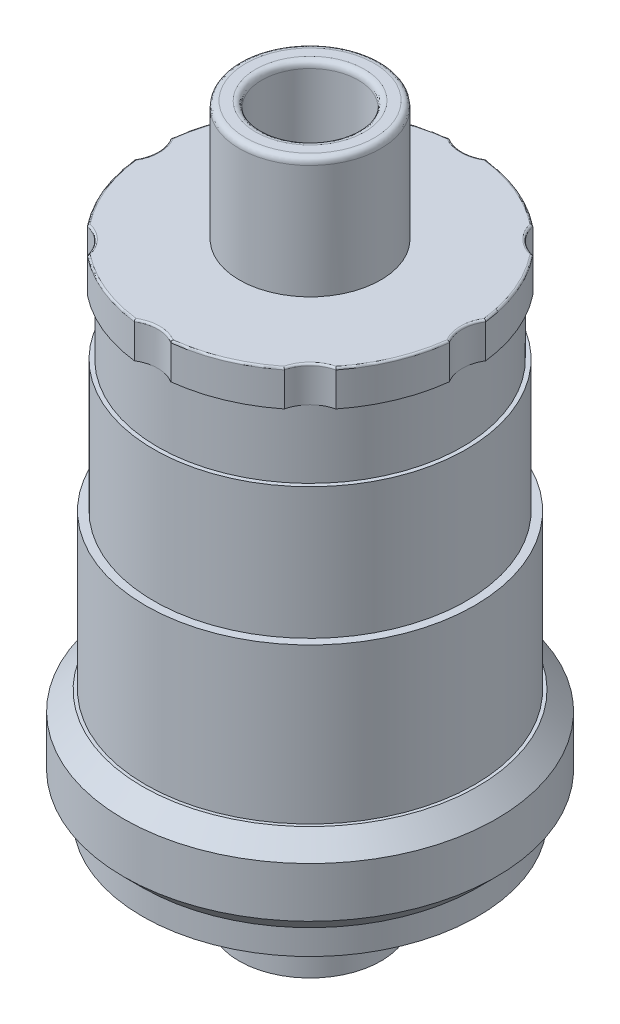
from build123d import *

# Parameters (mm, degrees)
SKETCH2_R            = 3.3
SKETCH2_R_2          = 1.9
CUT_EXTRUDE1_DEPTH   = 5
SKETCH5_R            = 26.8
BOSS_EXTRUDE3_DEPTH  = 4
SKETCH7_R            = 26.8
BOSS_EXTRUDE4_DEPTH  = 3
BOSS_EXTRUDE4_DRAFT  = -45
SKETCH8_R            = 29.8
BOSS_EXTRUDE5_DEPTH  = 8
SKETCH9_R            = 29.8
BOSS_EXTRUDE6_DEPTH  = 3
BOSS_EXTRUDE6_TAPER  = 45
SKETCH10_R           = 26.3
BOSS_EXTRUDE7_DEPTH  = 24.8
SKETCH11_R           = 25
BOSS_EXTRUDE8_DEPTH  = 21
SKETCH12_R           = 24.35
BOSS_EXTRUDE9_DEPTH  = 10.9
BOSS_EXTRUDE11_DEPTH = 5.7
FILLET1_R            = 0.3
SKETCH15_R           = 11.3
BOSS_EXTRUDE12_DEPTH = 19.2
SKETCH17_R           = 7.7
CUT_EXTRUDE3_DEPTH   = 20.2
FILLET3_SIZE         = 1


with BuildPart() as part:
    # Sketch1 → Revolve1 (revolve)
    with BuildSketch(Plane(origin=(0, 0, 0), x_dir=(0, 0, -1), z_dir=(1, 0, 0)), mode=Mode.PRIVATE) as revolve1_sk:
        Polygon((10.25, -8.254458515), (10.25, -13.954458515), (11.35, -13.954458515), (11.35, -0.054458515), (0, -0.054458515), (0, -8.254458515), align=None)
    revolve(revolve1_sk.sketch.rotate(Axis((0, 19.231781008, 0), (0, -1, 0)), 180), axis=Axis((0, 19.231781008, 0), (0, -1, 0)))

    # Sketch2 → Cut-Extrude1 (cut)
    with BuildSketch(Plane.XZ.offset(8.254458515)):
        with Locations(Location((0, 0, 0), (0, 0, 270))):
            Circle(SKETCH2_R)
        with Locations(Location((0, 6.695390408, 0), (0, 0, 270))):
            Circle(SKETCH2_R_2)
        with Locations(Location((4.73435596, 4.73435596, 0), (0, 0, 270))):
            Circle(SKETCH2_R_2)
        with Locations(Location((6.695390408, 0, 0), (0, 0, 270))):
            Circle(SKETCH2_R_2)
        with Locations(Location((4.73435596, -4.73435596, 0), (0, 0, 270))):
            Circle(SKETCH2_R_2)
        with Locations(Location((0, -6.695390408, 0), (0, 0, 270))):
            Circle(SKETCH2_R_2)
        with Locations(Location((-4.73435596, -4.73435596, 0), (0, 0, 270))):
            Circle(SKETCH2_R_2)
        with Locations(Location((-6.695390408, 0, 0), (0, 0, 270))):
            Circle(SKETCH2_R_2)
        with Locations(Location((-4.73435596, 4.73435596, 0), (0, 0, 270))):
            Circle(SKETCH2_R_2)
    extrude(amount=-CUT_EXTRUDE1_DEPTH, mode=Mode.SUBTRACT)

    # Sketch5 → Boss-Extrude3 (add)
    with BuildSketch(Plane(origin=(0, -0.054458515, 0), x_dir=(1, 0, 0), z_dir=(0, 1, 0))):
        with Locations(Location((0, 0, 0), (0, 0, 270))):
            Circle(SKETCH5_R)
    extrude(amount=BOSS_EXTRUDE3_DEPTH)


with BuildPart() as boss_extrude4_tool:
    # Sketch7 → Boss-Extrude4 (with draft: the straight prism first)
    with BuildSketch(Plane(origin=(0, 3.945541485, 0), x_dir=(1, 0, 0), z_dir=(0, 1, 0))):
        with Locations(Location((0, 0, 0), (0, 0, 270))):
            Circle(SKETCH7_R)
    extrude(amount=BOSS_EXTRUDE4_DEPTH)
    # Boss-Extrude4: the draft: its side faces are tilted about the plane it starts from
    boss_extrude4_sides = [boss_extrude4_tool.faces().sort_by_distance(p)[0] for p in [
        (0, 5.445541485, -26.8),
    ]]
    draft(boss_extrude4_sides, Plane(origin=(0, 3.945541485, 0), x_dir=(1, 0, 0), z_dir=(0, 1, 0)), BOSS_EXTRUDE4_DRAFT)


with BuildPart() as part_1:
    add(part.part)

    # Boss-Extrude4: add boss_extrude4_tool
    add(boss_extrude4_tool.part)

    # Sketch8 → Boss-Extrude5 (add)
    with BuildSketch(Plane(origin=(0, 6.945541485, 0), x_dir=(1, 0, 0), z_dir=(0, 1, 0))):
        with Locations(Location((0, 0, 0), (0, 0, 270))):
            Circle(SKETCH8_R)
    extrude(amount=BOSS_EXTRUDE5_DEPTH)

    # Sketch9 → Boss-Extrude6 (add)
    with BuildSketch(Plane(origin=(0, 14.945541485, 0), x_dir=(1, 0, 0), z_dir=(0, 1, 0))):
        with Locations(Location((0, 0, 0), (0, 0, 270))):
            Circle(SKETCH9_R)
    extrude(amount=BOSS_EXTRUDE6_DEPTH, taper=BOSS_EXTRUDE6_TAPER)

    # Sketch10 → Boss-Extrude7 (add)
    with BuildSketch(Plane(origin=(0, 17.945541485, 0), x_dir=(1, 0, 0), z_dir=(0, 1, 0))):
        with Locations(Location((0, 0, 0), (0, 0, 90))):
            Circle(SKETCH10_R)
    extrude(amount=BOSS_EXTRUDE7_DEPTH)

    # Sketch11 → Boss-Extrude8 (add)
    with BuildSketch(Plane(origin=(0, 42.745541485, 0), x_dir=(1, 0, 0), z_dir=(0, 1, 0))):
        with Locations(Location((0, 0, 0), (0, 0, 90))):
            Circle(SKETCH11_R)
    extrude(amount=BOSS_EXTRUDE8_DEPTH)

    # Sketch12 → Boss-Extrude9 (add)
    with BuildSketch(Plane(origin=(0, 63.745541485, 0), x_dir=(1, 0, 0), z_dir=(0, 1, 0))):
        with Locations(Location((0, 0, 0), (0, 0, 270))):
            Circle(SKETCH12_R)
    extrude(amount=BOSS_EXTRUDE9_DEPTH)

    # Sketch13 → Boss-Extrude11 (add)
    with BuildSketch(Plane(origin=(0, 74.645541485, 0), x_dir=(1, 0, 0), z_dir=(0, 1, 0))):
        with BuildLine():
            ThreePointArc((-19.861343042, 15.752763331), (-23.420346149, 9.70102501), (-25.182976122, 2.905204574))
            ThreePointArc((-25.182976122, 2.905204574), (-24.35, 0), (-25.182976122, -2.905204574))
            ThreePointArc((-25.182976122, -2.905204574), (-23.420346149, -9.70102501), (-19.861343042, -15.752763331))
            ThreePointArc((-19.861343042, -15.752763331), (-17.218050122, -17.218050122), (-15.752763331, -19.861343042))
            ThreePointArc((-15.752763331, -19.861343042), (-9.70102501, -23.420346149), (-2.905204574, -25.182976122))
            ThreePointArc((-2.905204574, -25.182976122), (0, -24.35), (2.905204574, -25.182976122))
            ThreePointArc((2.905204574, -25.182976122), (9.70102501, -23.420346149), (15.752763331, -19.861343042))
            ThreePointArc((15.752763331, -19.861343042), (17.218050122, -17.218050122), (19.861343042, -15.752763331))
            ThreePointArc((19.861343042, -15.752763331), (23.420346149, -9.70102501), (25.182976122, -2.905204574))
            ThreePointArc((25.182976122, -2.905204574), (24.35, 0), (25.182976122, 2.905204574))
            ThreePointArc((25.182976122, 2.905204574), (23.420346149, 9.70102501), (19.861343042, 15.752763331))
            ThreePointArc((19.861343042, 15.752763331), (17.218050122, 17.218050122), (15.752763331, 19.861343042))
            ThreePointArc((15.752763331, 19.861343042), (9.70102501, 23.420346149), (2.905204574, 25.182976122))
            ThreePointArc((2.905204574, 25.182976122), (0, 24.35), (-2.905204574, 25.182976122))
            ThreePointArc((-2.905204574, 25.182976122), (-9.70102501, 23.420346149), (-15.752763331, 19.861343042))
            ThreePointArc((-15.752763331, 19.861343042), (-17.218050122, 17.218050122), (-19.861343042, 15.752763331))
        make_face()
    extrude(amount=BOSS_EXTRUDE11_DEPTH)

    # Fillet1
    fillet1_edges = [part_1.edges().sort_by_distance(p)[0] for p in [
        (-9.70102501, 80.345541485, -23.420346149),
        (-17.218050122, 80.345541485, -17.218050122),
        (-23.420346149, 80.345541485, -9.70102501),
        (-24.35, 80.345541485, 0),
        (-23.420346149, 80.345541485, 9.70102501),
        (-17.218050122, 80.345541485, 17.218050122),
        (-9.70102501, 80.345541485, 23.420346149),
        (0, 80.345541485, 24.35),
        (9.70102501, 80.345541485, 23.420346149),
        (17.218050122, 80.345541485, 17.218050122),
        (23.420346149, 80.345541485, 9.70102501),
        (24.35, 80.345541485, 0),
        (23.420346149, 80.345541485, -9.70102501),
        (17.218050122, 80.345541485, -17.218050122),
        (9.70102501, 80.345541485, -23.420346149),
        (0, 80.345541485, -24.35),
    ]]
    fillet(fillet1_edges, radius=FILLET1_R)

    # Sketch15 → Boss-Extrude12 (add)
    with BuildSketch(Plane(origin=(0, 80.345541485, 0), x_dir=(1, 0, 0), z_dir=(0, 1, 0))):
        with Locations(Location((0, 0, 0), (0, 0, 270))):
            Circle(SKETCH15_R)
    extrude(amount=BOSS_EXTRUDE12_DEPTH)

    # Sketch17 → Cut-Extrude3 (cut)
    with BuildSketch(Plane(origin=(0, 99.545541485, 0), x_dir=(1, 0, 0), z_dir=(0, 1, 0))):
        with Locations(Location((0, 0, 0), (0, 0, 270))):
            Circle(SKETCH17_R)
    extrude(amount=-CUT_EXTRUDE3_DEPTH, mode=Mode.SUBTRACT)

    # Fillet3
    # a fillet whose section is not a circle: 1 mm, written as the material it takes off along each edge
    with BuildSketch(Plane(origin=(0, 99.545541485, 0), x_dir=(0, 0, 1), z_dir=(-1, 0, 0))) as fillet3_piece_1:
        with BuildLine():
            Bezier((11.3, -FILLET3_SIZE), (11.3, 0), (11.3 - FILLET3_SIZE, 0), weights=[1, 1, 1])
            Line((11.3 - FILLET3_SIZE, 0), (11.3, 0))
            Line((11.3, 0), (11.3, -FILLET3_SIZE))
        make_face()
    revolve(axis=Axis((0, 99.545541485, 0), (0, 1, 0)), mode=Mode.SUBTRACT)
    with BuildSketch(Plane(origin=(0, 99.545541485, 0), x_dir=(0, 0, 1), z_dir=(-1, 0, 0))) as fillet3_piece_2:
        with BuildLine():
            Bezier((7.7 + FILLET3_SIZE, 0), (7.7, 0), (7.7, -FILLET3_SIZE), weights=[1, 1, 1])
            Line((7.7, -FILLET3_SIZE), (7.7, 0))
            Line((7.7, 0), (7.7 + FILLET3_SIZE, 0))
        make_face()
    revolve(axis=Axis((0, 99.545541485, 0), (0, 1, 0)), mode=Mode.SUBTRACT)


solid = part_1.part
